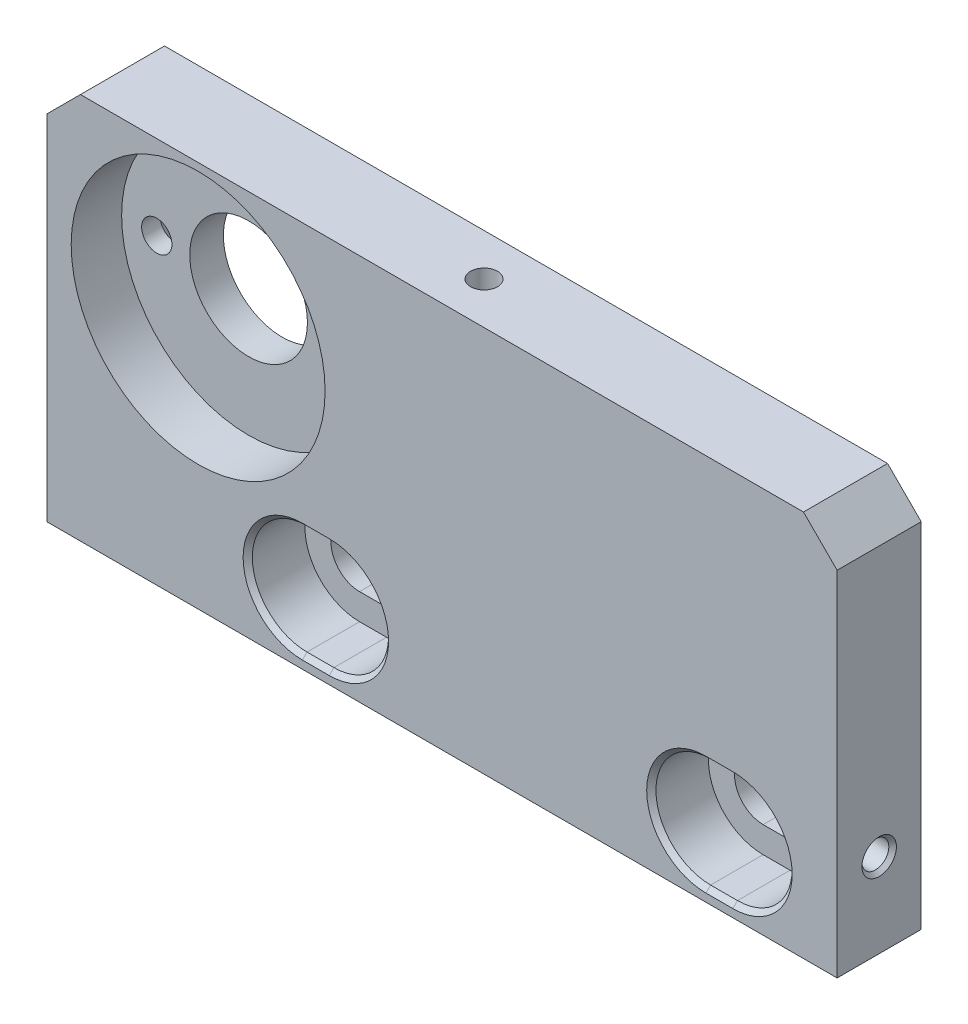
from build123d import *

# Parameters (mm, degrees)
SKIZZE1_W                                            = 47
SKIZZE1_H                                            = 23
AUFSATZ_LINEAR_AUSTRAGEN1_DEPTH                      = 5
SKIZZE2_R                                            = 7.55
SCHNITT_LINEAR_AUSTRAGEN1_DEPTH                      = 3
SKIZZE3_R                                            = 3.5
SCHNITT_LINEAR_AUSTRAGEN2_DEPTH                      = 27.636441204
FORMSENKUNG_F_R_M1_6_SENKSCHRAUBE_MIT_SC_D           = 1.8
FORMSENKUNG_F_R_M1_6_SENKSCHRAUBE_MIT_SC_CSINK_D     = 3.6
FORMSENKUNG_F_R_M1_6_SENKSCHRAUBE_MIT_SC_CSINK_ANGLE = 90
M2_GEWINDEBOHRUNG1_D                                 = 1.6
M2_GEWINDEBOHRUNG1_DEPTH                             = 8
M2_GEWINDEBOHRUNG1_CSINK_D                           = 2.05
M2_GEWINDEBOHRUNG1_CSINK_ANGLE                       = 90
M2_GEWINDEBOHRUNG1_TIP                               = 0.480688495
M2_GEWINDEBOHRUNG2_D                                 = 1.6
M2_GEWINDEBOHRUNG2_DEPTH                             = 8
M2_GEWINDEBOHRUNG2_CSINK_D                           = 2.05
M2_GEWINDEBOHRUNG2_CSINK_ANGLE                       = 90
M2_GEWINDEBOHRUNG2_TIP                               = 0.480688495
M2_GEWINDEBOHRUNG3_D                                 = 1.6
M2_GEWINDEBOHRUNG3_DEPTH                             = 8
M2_GEWINDEBOHRUNG3_TIP                               = 0.480688495
FASE1_SIZE                                           = 2
STIRNSENKUNG_START                                   = 1.6
STIRNSENKUNG_LANGLOCH_F_R_M3_ZYLINDERSCH_DEPTH       = 3.4
STIRNSENKUNG_START_2                                 = -1
STIRNSENKUNG_LANGLOCH_F_R_M3_ZYLINDE_3_DEPTH         = 2.6


with BuildPart() as part:
    # Skizze1 → Aufsatz-Linear austragen1 (new body)
    with BuildSketch(Plane.XY):
        Rectangle(SKIZZE1_W, SKIZZE1_H)
    extrude(amount=AUFSATZ_LINEAR_AUSTRAGEN1_DEPTH)

    # Skizze2 → Schnitt-Linear austragen1 (cut)
    with BuildSketch(Plane.XY.offset(5)):
        with Locations((-14.5, 3.5)):
            Circle(SKIZZE2_R)
    extrude(amount=-SCHNITT_LINEAR_AUSTRAGEN1_DEPTH, mode=Mode.SUBTRACT)

    # Skizze3 → Schnitt-Linear austragen2 (cut, through all)
    with BuildSketch(Plane.XY.offset(5)):
        with Locations((-14.5, 3.5)):
            Circle(SKIZZE3_R)
    extrude(amount=-SCHNITT_LINEAR_AUSTRAGEN2_DEPTH, mode=Mode.SUBTRACT)

    # Formsenkung für M1.6 Senkschraube mit Schlitz/Kreuzschlitz1 (through all)
    with Locations(Plane(origin=(0, 0, 0), x_dir=(-1, 0, 0), z_dir=(0, 0, -1))):
        with Locations((9.04, 3.5), (19.96, 3.5)):
            CounterSinkHole(FORMSENKUNG_F_R_M1_6_SENKSCHRAUBE_MIT_SC_D / 2, FORMSENKUNG_F_R_M1_6_SENKSCHRAUBE_MIT_SC_CSINK_D / 2, counter_sink_angle=FORMSENKUNG_F_R_M1_6_SENKSCHRAUBE_MIT_SC_CSINK_ANGLE)

    # M2 Gewindebohrung1
    with Locations(Plane.ZY.offset(23.5)):
        with Locations((2.5, -6.5)):
            CounterSinkHole(M2_GEWINDEBOHRUNG1_D / 2, M2_GEWINDEBOHRUNG1_CSINK_D / 2, depth=M2_GEWINDEBOHRUNG1_DEPTH, counter_sink_angle=M2_GEWINDEBOHRUNG1_CSINK_ANGLE)
            with Locations((0, 0, -(M2_GEWINDEBOHRUNG1_DEPTH + M2_GEWINDEBOHRUNG1_TIP / 2))):  # 118° drill point
                Cone(0, M2_GEWINDEBOHRUNG1_D / 2, M2_GEWINDEBOHRUNG1_TIP, mode=Mode.SUBTRACT)

    # M2 Gewindebohrung2
    with Locations(Plane(origin=(23.5, 0, 0), x_dir=(0, 0, -1), z_dir=(1, 0, 0))):
        with Locations((-2.5, -6.5)):
            CounterSinkHole(M2_GEWINDEBOHRUNG2_D / 2, M2_GEWINDEBOHRUNG2_CSINK_D / 2, depth=M2_GEWINDEBOHRUNG2_DEPTH, counter_sink_angle=M2_GEWINDEBOHRUNG2_CSINK_ANGLE)
            with Locations((0, 0, -(M2_GEWINDEBOHRUNG2_DEPTH + M2_GEWINDEBOHRUNG2_TIP / 2))):  # 118° drill point
                Cone(0, M2_GEWINDEBOHRUNG2_D / 2, M2_GEWINDEBOHRUNG2_TIP, mode=Mode.SUBTRACT)

    # M2 Gewindebohrung3
    with Locations(Plane(origin=(0, 11.5, 0), x_dir=(1, 0, 0), z_dir=(0, 1, 0))):
        with Locations((0, -2.5)):
            Hole(M2_GEWINDEBOHRUNG3_D / 2, depth=M2_GEWINDEBOHRUNG3_DEPTH)
            with Locations((0, 0, -(M2_GEWINDEBOHRUNG3_DEPTH + M2_GEWINDEBOHRUNG3_TIP / 2))):  # 118° drill point
                Cone(0, M2_GEWINDEBOHRUNG3_D / 2, M2_GEWINDEBOHRUNG3_TIP, mode=Mode.SUBTRACT)

    # Fase1
    fase1_edges = [part.edges().sort_by_distance(p)[0] for p in [
        (-23.5, 11.5, 2.5),
        (23.5, 11.5, 2.5),
    ]]
    chamfer(fase1_edges, length=FASE1_SIZE)

    # Stirnsenkung Langloch für M3 Zylinderschraube mit Innensechskant2: read off the stored shape, not the designer's step
    # Stirnsenkung Langloch f_r M3 Zylinde 2 → Stirnsenkung Langloch für M3 Zylinderschraube mit Innensechskant2 (cut)
    with BuildSketch(Plane.XY.offset(STIRNSENKUNG_START)):
        with BuildLine():
            Line((-8.3, -10.75), (-6.7, -10.75))
            ThreePointArc((-6.7, -10.75), (-3.45, -7.5), (-6.7, -4.25))
            Line((-6.7, -4.25), (-8.3, -4.25))
            ThreePointArc((-8.3, -4.25), (-11.55, -7.5), (-8.3, -10.75))
        make_face()
        with BuildLine():
            ThreePointArc((17.3, -10.75), (20.55, -7.5), (17.3, -4.25))
            Line((17.3, -4.25), (15.7, -4.25))
            ThreePointArc((15.7, -4.25), (12.45, -7.5), (15.7, -10.75))
            Line((15.7, -10.75), (17.3, -10.75))
        make_face()
    extrude(amount=STIRNSENKUNG_LANGLOCH_F_R_M3_ZYLINDERSCH_DEPTH, mode=Mode.SUBTRACT)

    # Stirnsenkung Langloch f_r M3 Zylinde 3 o → Stirnsenkung Langloch f_r M3 Zylinde 3 (cut)
    with BuildSketch(Plane.XY.offset(STIRNSENKUNG_START_2)):
        with BuildLine():
            Line((-8.3, -9.2), (-6.7, -9.2))
            ThreePointArc((-6.7, -9.2), (-5, -7.5), (-6.7, -5.8))
            Line((-6.7, -5.8), (-8.3, -5.8))
            ThreePointArc((-8.3, -5.8), (-10, -7.5), (-8.3, -9.2))
        make_face()
        with BuildLine():
            ThreePointArc((17.3, -9.2), (19, -7.5), (17.3, -5.8))
            Line((17.3, -5.8), (15.7, -5.8))
            ThreePointArc((15.7, -5.8), (14, -7.5), (15.7, -9.2))
            Line((15.7, -9.2), (17.3, -9.2))
        make_face()
    extrude(amount=STIRNSENKUNG_LANGLOCH_F_R_M3_ZYLINDE_3_DEPTH, mode=Mode.SUBTRACT)

    # Stirnsenkung Langloch f_r M3 Zylinde 4: loft between two sections, ruled curve by curve
    stirnsenkung_langloch_f_r_m3_zylinde_4_from = [
        Edge.make_three_point_arc((-6.7, -10.75, 4.725), (-4.401902961, -9.798097039, 4.725), (-3.45, -7.5, 4.725)),
        Edge.make_three_point_arc((-3.45, -7.5, 4.725), (-4.401902961, -5.201902961, 4.725), (-6.7, -4.25, 4.725)),
        Edge.make_three_point_arc((-8.3, -4.25, 4.725), (-10.598097039, -5.201902961, 4.725), (-11.55, -7.5, 4.725)),
        Edge.make_three_point_arc((-11.55, -7.5, 4.725), (-10.598097039, -9.798097039, 4.725), (-8.3, -10.75, 4.725)),
        Edge.make_line((-6.7, -4.25, 4.725), (-8.3, -4.25, 4.725)),
        Edge.make_line((-6.7, -10.75, 4.725), (-8.3, -10.75, 4.725)),
    ]
    stirnsenkung_langloch_f_r_m3_zylinde_4_to = [
        Edge.make_three_point_arc((-6.7, -11.025, 5), (-4.207448596, -9.992551404, 5), (-3.175, -7.5, 5)),
        Edge.make_three_point_arc((-3.175, -7.5, 5), (-4.207448596, -5.007448596, 5), (-6.7, -3.975, 5)),
        Edge.make_three_point_arc((-8.3, -3.975, 5), (-10.792551404, -5.007448596, 5), (-11.825, -7.5, 5)),
        Edge.make_three_point_arc((-11.825, -7.5, 5), (-10.792551404, -9.992551404, 5), (-8.3, -11.025, 5)),
        Edge.make_line((-6.7, -3.975, 5), (-8.3, -3.975, 5)),
        Edge.make_line((-6.7, -11.025, 5), (-8.3, -11.025, 5)),
    ]
    stirnsenkung_langloch_f_r_m3_zylinde_4 = Solid(Shell([*[Face.make_surface_from_curves(stirnsenkung_langloch_f_r_m3_zylinde_4_from[k], stirnsenkung_langloch_f_r_m3_zylinde_4_to[k]) for k in range(6)], Face(Wire(stirnsenkung_langloch_f_r_m3_zylinde_4_from)), Face(Wire(stirnsenkung_langloch_f_r_m3_zylinde_4_to))]))
    add(stirnsenkung_langloch_f_r_m3_zylinde_4, mode=Mode.SUBTRACT)

    # Stirnsenkung Langloch f_r M3 Zylinde 5: loft between two sections, ruled curve by curve
    stirnsenkung_langloch_f_r_m3_zylinde_5_from = [
        Edge.make_three_point_arc((17.3, -10.75, 4.725), (19.598097039, -9.798097039, 4.725), (20.55, -7.5, 4.725)),
        Edge.make_three_point_arc((20.55, -7.5, 4.725), (19.598097039, -5.201902961, 4.725), (17.3, -4.25, 4.725)),
        Edge.make_three_point_arc((15.7, -4.25, 4.725), (13.401902961, -5.201902961, 4.725), (12.45, -7.5, 4.725)),
        Edge.make_three_point_arc((12.45, -7.5, 4.725), (13.401902961, -9.798097039, 4.725), (15.7, -10.75, 4.725)),
        Edge.make_line((17.3, -4.25, 4.725), (15.7, -4.25, 4.725)),
        Edge.make_line((17.3, -10.75, 4.725), (15.7, -10.75, 4.725)),
    ]
    stirnsenkung_langloch_f_r_m3_zylinde_5_to = [
        Edge.make_three_point_arc((17.3, -11.025, 5), (19.792551404, -9.992551404, 5), (20.825, -7.5, 5)),
        Edge.make_three_point_arc((20.825, -7.5, 5), (19.792551404, -5.007448596, 5), (17.3, -3.975, 5)),
        Edge.make_three_point_arc((15.7, -3.975, 5), (13.207448596, -5.007448596, 5), (12.175, -7.5, 5)),
        Edge.make_three_point_arc((12.175, -7.5, 5), (13.207448596, -9.992551404, 5), (15.7, -11.025, 5)),
        Edge.make_line((17.3, -3.975, 5), (15.7, -3.975, 5)),
        Edge.make_line((17.3, -11.025, 5), (15.7, -11.025, 5)),
    ]
    stirnsenkung_langloch_f_r_m3_zylinde_5 = Solid(Shell([*[Face.make_surface_from_curves(stirnsenkung_langloch_f_r_m3_zylinde_5_from[k], stirnsenkung_langloch_f_r_m3_zylinde_5_to[k]) for k in range(6)], Face(Wire(stirnsenkung_langloch_f_r_m3_zylinde_5_from)), Face(Wire(stirnsenkung_langloch_f_r_m3_zylinde_5_to))]))
    add(stirnsenkung_langloch_f_r_m3_zylinde_5, mode=Mode.SUBTRACT)


solid = part.part
